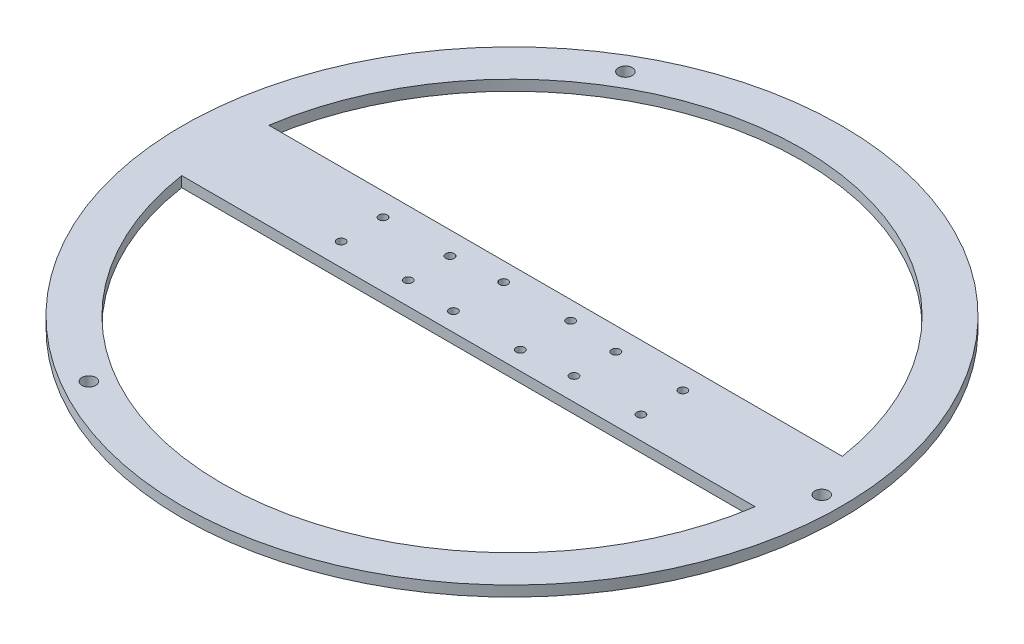
from build123d import *

# Parameters (mm, degrees)
SKETCH1_R           = 100
SKETCH1_R_2         = 1.27
SKETCH1_R_3         = 2.1
BOSS_EXTRUDE1_DEPTH = 3.175


with BuildPart() as part:
    # Sketch1 → Boss-Extrude1 (new body)
    with BuildSketch(Plane(origin=(0, 0, 0), x_dir=(1, 0, 0), z_dir=(0, 1, 0))):
        Circle(SKETCH1_R)
        with Locations((-10.16, 7.62)):
            Circle(SKETCH1_R_2, mode=Mode.SUBTRACT)
        with Locations((-10.16, -7.62)):
            Circle(SKETCH1_R_2, mode=Mode.SUBTRACT)
        with Locations((10.16, -7.62)):
            Circle(SKETCH1_R_2, mode=Mode.SUBTRACT)
        with Locations((10.16, 7.62)):
            Circle(SKETCH1_R_2, mode=Mode.SUBTRACT)
        with Locations((25.16, 6.35)):
            Circle(SKETCH1_R_2, mode=Mode.SUBTRACT)
        with Locations((25.16, -6.35)):
            Circle(SKETCH1_R_2, mode=Mode.SUBTRACT)
        with Locations((45.48, -6.35)):
            Circle(SKETCH1_R_2, mode=Mode.SUBTRACT)
        with Locations((45.48, 6.35)):
            Circle(SKETCH1_R_2, mode=Mode.SUBTRACT)
        with Locations((-45.48, 6.35)):
            Circle(SKETCH1_R_2, mode=Mode.SUBTRACT)
        with Locations((-45.48, -6.35)):
            Circle(SKETCH1_R_2, mode=Mode.SUBTRACT)
        with Locations((-25.16, -6.35)):
            Circle(SKETCH1_R_2, mode=Mode.SUBTRACT)
        with Locations((-25.16, 6.35)):
            Circle(SKETCH1_R_2, mode=Mode.SUBTRACT)
        with Locations((94, 0)):
            Circle(SKETCH1_R_3, mode=Mode.SUBTRACT)
        with Locations((-47, -81.406387956)):
            Circle(SKETCH1_R_3, mode=Mode.SUBTRACT)
        with Locations((-47, 81.406387956)):
            Circle(SKETCH1_R_3, mode=Mode.SUBTRACT)
        with BuildLine():
            Line((-87, 13.228756555), (87, 13.228756555))
            ThreePointArc((87, 13.228756555), (0, 88), (-87, 13.228756555))
        make_face(mode=Mode.SUBTRACT)
        with BuildLine():
            Line((-87, -13.228756555), (87, -13.228756555))
            ThreePointArc((87, -13.228756555), (0, -88), (-87, -13.228756555))
        make_face(mode=Mode.SUBTRACT)
    extrude(amount=BOSS_EXTRUDE1_DEPTH)


solid = part.part
